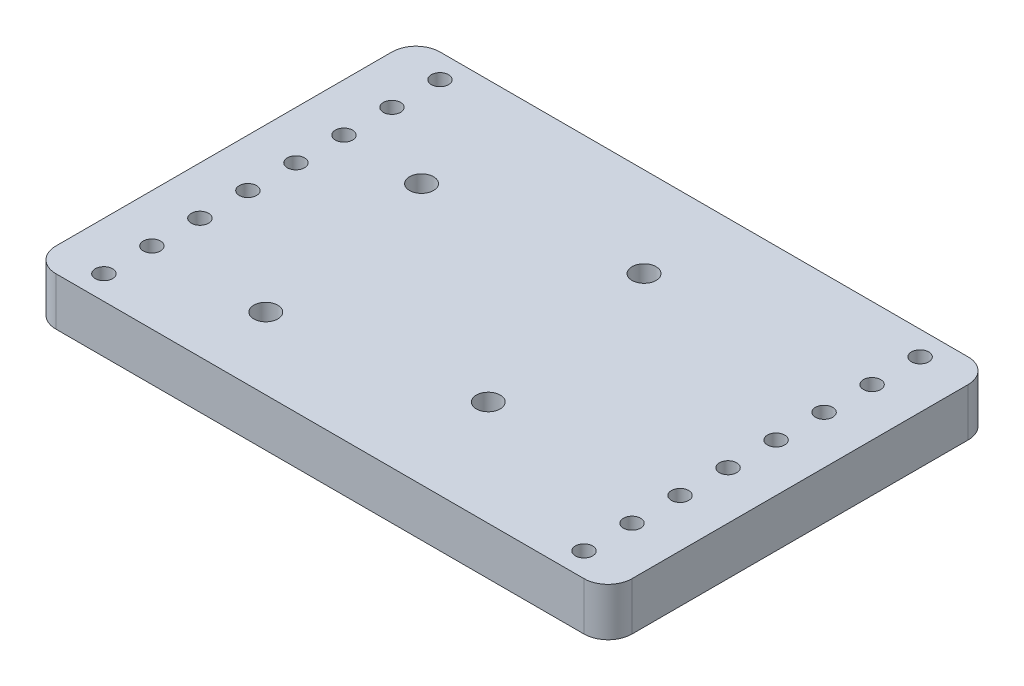
from build123d import *

# Parameters (mm, degrees)
SKETCH1_W                   = 152.4
SKETCH1_H                   = 101.6
INITIAL_PLATE_DEPTH         = 12.7
SKETCH2_R                   = 3.175
BEARING_STACK_HOLES_DEPTH   = 93.457395594
SKETCH3_R                   = 2.286
INITIAL_MOUNTING_HOLE_DEPTH = 93.457395594
MOUNTING_PATTERN_COUNT      = 8
MOUNTING_PATTERN_PITCH      = 12.7
FILLET1_R                   = 6.35


with BuildPart() as part:
    # Sketch1 → Initial Plate (new body)
    with BuildSketch(Plane(origin=(0, 0, 0), x_dir=(1, 0, 0), z_dir=(0, 1, 0))):
        Rectangle(SKETCH1_W, SKETCH1_H)
    extrude(amount=INITIAL_PLATE_DEPTH)

    # Sketch2 → Bearing Stack Holes (cut, through all)
    with BuildSketch(Plane(origin=(0, 12.7, 0), x_dir=(1, 0, 0), z_dir=(0, 1, 0))):
        with Locations((-42.124780639, 18.200275399)):
            Circle(SKETCH2_R)
        with Locations((-33.303453214, -31.827958454)):
            Circle(SKETCH2_R)
        with Locations((16.724780639, -23.006631028)):
            Circle(SKETCH2_R)
        with Locations((7.903453214, 27.021602825)):
            Circle(SKETCH2_R)
    extrude(amount=-BEARING_STACK_HOLES_DEPTH, mode=Mode.SUBTRACT)

    # Sketch3 → Initial Mounting Hole (cut, through all)
    with BuildSketch(Plane(origin=(0, 12.7, 0), x_dir=(1, 0, 0), z_dir=(0, 1, 0))):
        with Locations((-63.5, -44.45)):
            Circle(SKETCH3_R)
        with Locations((63.5, -44.45)):
            Circle(SKETCH3_R)
    initial_mounting_hole = extrude(amount=-INITIAL_MOUNTING_HOLE_DEPTH, mode=Mode.SUBTRACT)

    # Mounting Pattern: Initial Mounting Hole ×8
    with Locations(*[(0, 0, -i * MOUNTING_PATTERN_PITCH) for i in range(1, MOUNTING_PATTERN_COUNT)]):
        add(initial_mounting_hole, mode=Mode.SUBTRACT)

    # Fillet1
    fillet1_edges = [part.edges().sort_by_distance(p)[0] for p in [
        (76.2, 6.35, -50.8),
        (76.2, 6.35, 50.8),
        (-76.2, 6.35, 50.8),
        (-76.2, 6.35, -50.8),
    ]]
    fillet(fillet1_edges, radius=FILLET1_R)


solid = part.part
